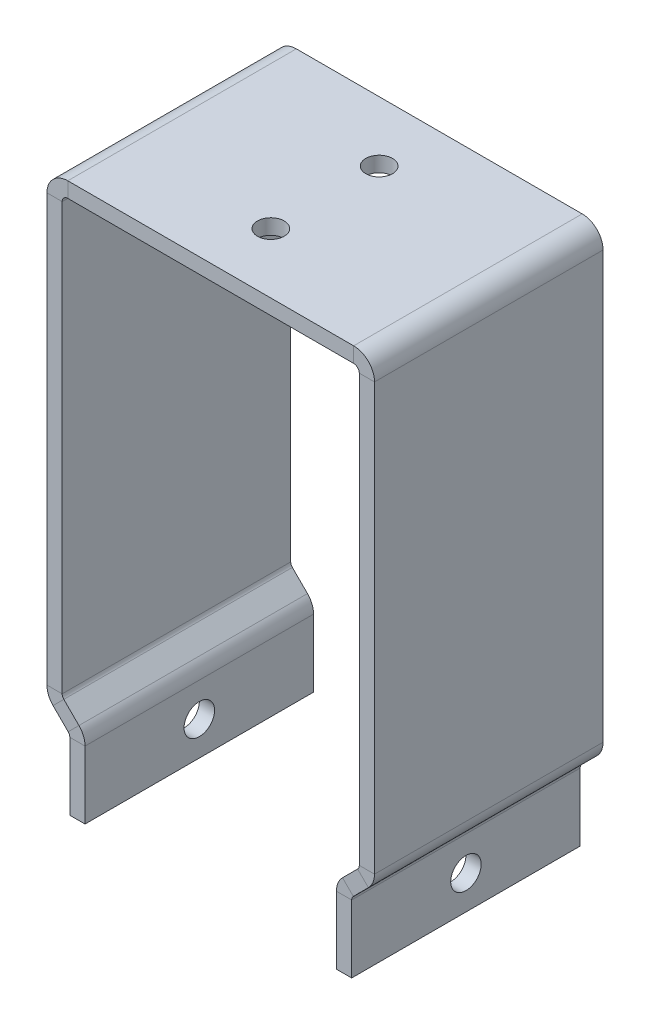
from build123d import *

# Parameters (mm, degrees)
BASE_FLANGE1_DEPTH = 30
SKETCH9_R          = 2
CUT_EXTRUDE1_DEPTH = 84.600239234
SKETCH10_R         = 1.75
CUT_EXTRUDE2_DEPTH = 10


# Sheet-metal steps are written as plain solids
with BuildPart() as part:
    # Sketch1 → Base-Flange1 (new body)
    with BuildSketch(Plane.XY):
        with BuildLine():
            Line((-16.5, -5), (-16.5, 3.866463165))
            ThreePointArc((-16.5, 3.866463165), (-16.708311271, 4.913714646), (-17.301531583, 5.801531583))
            Line((-17.301531583, 5.801531583), (-19.284254855, 7.784254855))
            ThreePointArc((-19.284254855, 7.784254855), (-19.443929664, 8.023225094), (-19.5, 8.30510971))
            Line((-19.5, 8.30510971), (-19.5, 64.2634))
            ThreePointArc((-19.5, 64.2634), (-19.284254855, 64.784254855), (-18.7634, 65))
            Line((-18.7634, 65), (18.7634, 65))
            ThreePointArc((18.7634, 65), (19.284254855, 64.784254855), (19.5, 64.2634))
            Line((19.5, 64.2634), (19.5, 8.30510971))
            ThreePointArc((19.5, 8.30510971), (19.443929664, 8.023225094), (19.284254855, 7.784254855))
            Line((19.284254855, 7.784254855), (17.301531583, 5.801531583))
            ThreePointArc((17.301531583, 5.801531583), (16.708311271, 4.913714646), (16.5, 3.866463165))
            Line((16.5, 3.866463165), (16.5, -5))
            Line((16.5, -5), (18.5, -5))
            Line((18.5, -5), (18.5, 3.866463165))
            ThreePointArc((18.5, 3.866463165), (18.556070336, 4.148347781), (18.715745145, 4.38731802))
            Line((18.715745145, 4.38731802), (20.698468417, 6.370041293))
            ThreePointArc((20.698468417, 6.370041293), (21.291688729, 7.257858229), (21.5, 8.30510971))
            Line((21.5, 8.30510971), (21.5, 64.2634))
            ThreePointArc((21.5, 64.2634), (20.698468417, 66.198468417), (18.7634, 67))
            Line((18.7634, 67), (-18.7634, 67))
            ThreePointArc((-18.7634, 67), (-20.698468417, 66.198468417), (-21.5, 64.2634))
            Line((-21.5, 64.2634), (-21.5, 8.30510971))
            ThreePointArc((-21.5, 8.30510971), (-21.291688729, 7.257858229), (-20.698468417, 6.370041293))
            Line((-20.698468417, 6.370041293), (-18.715745145, 4.38731802))
            ThreePointArc((-18.715745145, 4.38731802), (-18.556070336, 4.148347781), (-18.5, 3.866463165))
            Line((-18.5, 3.866463165), (-18.5, -5))
            Line((-18.5, -5), (-16.5, -5))
        make_face()
    extrude(amount=BASE_FLANGE1_DEPTH)

    # Sketch9 → Cut-Extrude1 (cut, through all)
    with BuildSketch(Plane.ZY.offset(18.5)):
        with Locations((15, -0.566768417)):
            Circle(SKETCH9_R)
    extrude(amount=-CUT_EXTRUDE1_DEPTH, mode=Mode.SUBTRACT)

    # Sketch10 → Cut-Extrude2 (cut)
    with BuildSketch(Plane(origin=(0, 67, 0), x_dir=(1, 0, 0), z_dir=(0, 1, 0))):
        with Locations(Location((0, -22.108972385, 0), (0, 0, 270))):
            Circle(SKETCH10_R)
        with Locations(Location((0, -7.891027615, 0), (0, 0, 270))):
            Circle(SKETCH10_R)
    extrude(amount=-CUT_EXTRUDE2_DEPTH, mode=Mode.SUBTRACT)


solid = part.part
